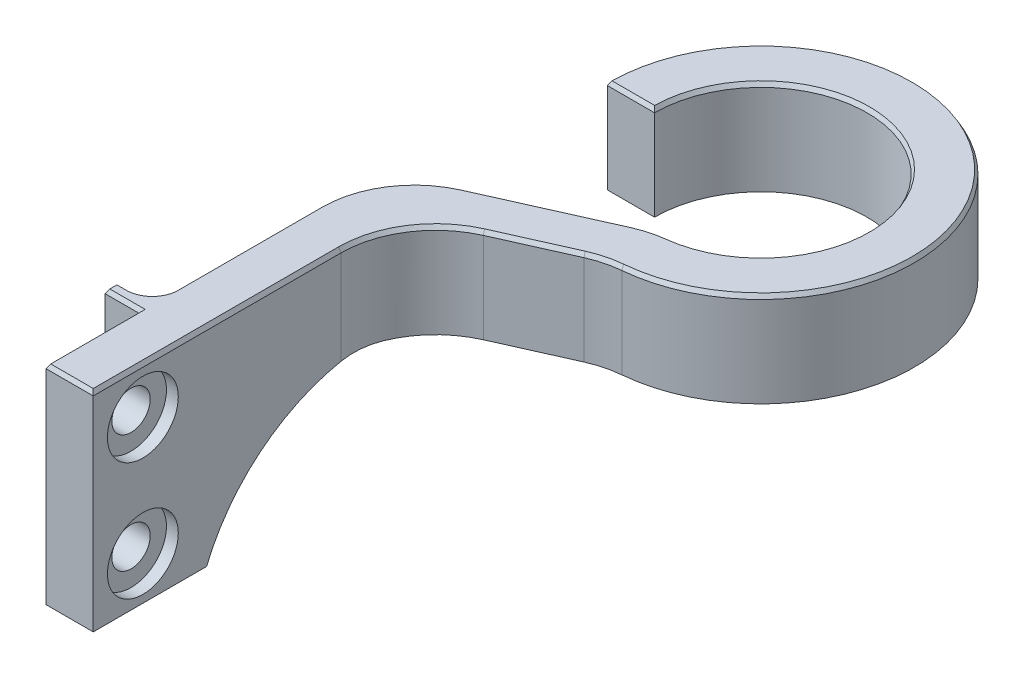
from build123d import *

# Parameters (mm, degrees)
BOSS_EXTRUDE1_DEPTH = 8
BOSS_EXTRUDE2_DEPTH = 4
FILLET1_R           = 8
SKETCH3_R           = 1.625
CUT_EXTRUDE1_DEPTH  = 52.963032648
SKETCH4_R           = 3
CUT_EXTRUDE2_DEPTH  = 1
SKETCH5_W           = 1
SKETCH5_H           = 17.649761518
BOSS_EXTRUDE3_DEPTH = 3
FILLET2_R           = 2
CHAMFER1_SIZE       = 0.2
CHAMFER1_SIZE2      = 0.346410162


with BuildPart() as part:
    # Sketch1 → Boss-Extrude1 (new body)
    with BuildSketch(Plane(origin=(0, 0, 0), x_dir=(1, 0, 0), z_dir=(0, 1, 0))):
        with BuildLine():
            Line((-16, -16.133170244), (-16, -44.520095044))
            Line((-16, -44.520095044), (-12, -44.520095044))
            Line((-12, -44.520095044), (-12, -18.349877683))
            Line((-12, -18.349877683), (0, -13))
            ThreePointArc((0, -13), (9.192388155, 9.192388155), (-13, 0))
            Line((-13, 0), (-9, 0))
            ThreePointArc((-9, 0), (6.363961031, 6.363961031), (0, -9))
            Line((0, -9), (-16, -16.133170244))
        make_face()
    extrude(amount=BOSS_EXTRUDE1_DEPTH)

    # Sketch2 → Boss-Extrude2 (add)
    with BuildSketch(Plane.ZY.offset(16)):
        with BuildLine():
            Line((44.520095044, 0), (44.520095044, -9.649761518))
            Line((44.520095044, -9.649761518), (34.926950901, -9.649761518))
            ThreePointArc((34.926950901, -9.649761518), (29.19009206, -2.635329296), (20.520095044, 0))
            Line((20.520095044, 0), (44.520095044, 0))
        make_face()
    extrude(amount=-BOSS_EXTRUDE2_DEPTH)

    # Fillet1
    fillet1_edges = [part.edges().sort_by_distance(p)[0] for p in [
        (0, 4, 13),
        (-12, 4, 18.349877683),
    ]]
    fillet(fillet1_edges, radius=FILLET1_R)
    fillet1_2_edges = [part.edges().sort_by_distance(p)[0] for p in [
        (0, 4, 9),
        (-16, 4, 16.133170244),
    ]]
    fillet(fillet1_2_edges, radius=FILLET1_R)

    # Sketch3 → Cut-Extrude1 (cut, through all)
    with BuildSketch(Plane(origin=(-12, 0, 0), x_dir=(0, 0, -1), z_dir=(1, 0, 0))):
        with Locations((-40.320095044, 4)):
            Circle(SKETCH3_R)
        with Locations((-40.320095044, -6)):
            Circle(SKETCH3_R)
    extrude(amount=-CUT_EXTRUDE1_DEPTH, mode=Mode.SUBTRACT)

    # Sketch4 → Cut-Extrude2 (cut)
    with BuildSketch(Plane(origin=(-12, 0, 0), x_dir=(0, 0, -1), z_dir=(1, 0, 0))):
        with Locations((-40.320095044, 4)):
            Circle(SKETCH4_R)
        with Locations((-40.320095044, -6)):
            Circle(SKETCH4_R)
    extrude(amount=-CUT_EXTRUDE2_DEPTH, mode=Mode.SUBTRACT)

    # Sketch5 → Boss-Extrude3 (add)
    with BuildSketch(Plane.ZY.offset(16)):
        with Locations((36.020095044, -0.824880759)):
            Rectangle(SKETCH5_W, SKETCH5_H)
    extrude(amount=BOSS_EXTRUDE3_DEPTH)

    # Fillet2
    fillet2_edges = [part.edges().sort_by_distance(p)[0] for p in [
        (-16, -0.824880759, 35.520095044),
    ]]
    fillet(fillet2_edges, radius=FILLET2_R)

    # Chamfer1
    chamfer1_edges = [part.edges().sort_by_distance(p)[0] for p in [
        (-19, 8, 36.020095044),
        (-17.5, 8, 36.520095044),
        (-16, 8, 40.520095044),
        (-14, 8, 44.520095044),
        (-11, 8, 0),
        (8.767918657, 8, -9.598104105),
        (-0.122248691, 8, 13.172767977),
        (-12, 8, 34.031206601),
        (-4.310206163, 8, 14.921589647),
        (-10.710444905, 8, 19.186869942),
        (5.986723158, 8, -6.720055493),
        (-0.157609097, 8, 9.171307852),
        (-18.5, 8, 35.520095044),
        (-6.279672286, 8, 11.799623218),
        (-16.585786438, 8, 34.934308606),
        (-16, 8, 27.422852882),
        (-14.710444905, 8, 16.970162503),
    ]]
    chamfer1_side = [part.faces().sort_by_distance(p)[0] for p in [
        (-15.341778052, 8, 27.422852882),
    ]]
    chamfer(chamfer1_edges, length=CHAMFER1_SIZE, length2=CHAMFER1_SIZE2, reference=chamfer1_side[0])


solid = part.part
